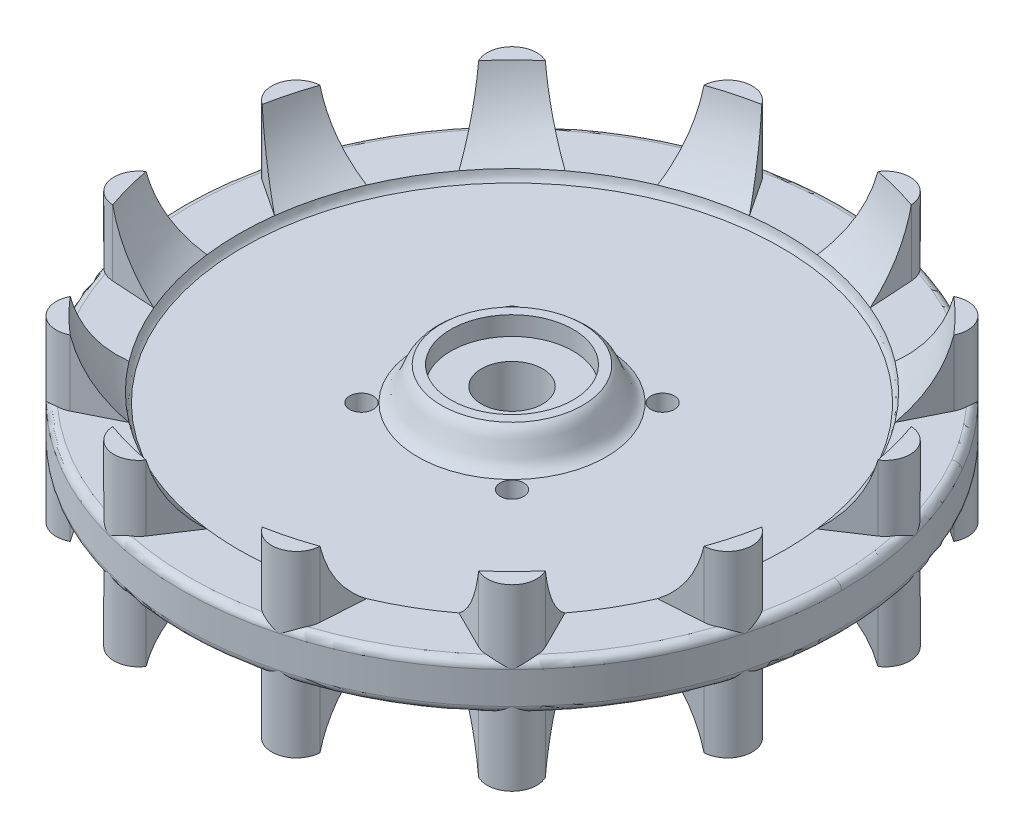
from build123d import *

# Parameters (mm, degrees)
BOSS_EXTRUDE1_DEPTH            = 7.9375
FILLET2_R                      = 2.54
BOSS_EXTRUDE3_START            = -38.1
BOSS_EXTRUDE3_DEPTH            = 60.325
CIRPATTERN8_COUNT              = 12
FILLET5_R                      = 2.54
CIRPATTERN9_COUNT              = 12
SKETCH5_R                      = 10.31875
CUT_EXTRUDE1_DEPTH             = 9.525
SKETCH7_R                      = 31.75
SKETCH7_R_2                    = 10.31875
BOSS_EXTRUDE4_DEPTH            = 15.875
CUT_EXTRUDE2_START             = -6.35
SKETCH8_R                      = 20.6375
SKETCH8_R_2                    = 10.31875
CUT_EXTRUDE2_DEPTH             = 6.35
CUT_EXTRUDE3_REACH             = 162.023
SKETCH10_R                     = 3.968750000000001
SKETCH10_R_2                   = 3.9687499999994156
SKETCH10_R_3                   = 3.968749999999999
SKETCH10_R_4                   = 3.9687499999996922
CUT_EXTRUDE3_DIRECTION_2_REACH = 162.023


with BuildPart() as part:
    # Sketch1 → Boss-Extrude1 (new, symmetric)
    with BuildSketch(Plane(origin=(0, 0, 0), x_dir=(1, 0, 0), z_dir=(0, 1, 0))):
        with BuildLine():
            Line((0, 0), (111.125, 0))
            ThreePointArc((111.125, 0), (107.33850744637269, 28.7612663870177), (96.23707299554566, 55.56250000000014))
            Line((96.23707299554566, 55.56250000000014), (0, 0))
        make_face()
    boss_extrude1 = extrude(amount=BOSS_EXTRUDE1_DEPTH, both=True)

    # Fillet2
    fillet2_edges = [part.edges().sort_by_distance(p)[0] for p in [
        (107.33850744637266, 7.9375, -28.7612663870177),
        (107.33850744637266, -7.9375, -28.7612663870177),
    ]]
    fillet(fillet2_edges, radius=FILLET2_R)

    # Sketch3 → Boss-Extrude3 (add)
    with BuildSketch(Plane(origin=(0, 7.9375, 0), x_dir=(1, 0, 0), z_dir=(0, 1, 0)).offset(BOSS_EXTRUDE3_START)):
        with BuildLine():
            Line((84.80053818599464, 35.870243215869976), (99.76659115583168, 34.9498822138162))
            ThreePointArc((99.76659115583168, 34.9498822138162), (107.3385074463727, 28.7612663870177), (103.87534349683419, 19.615809721477245))
            Line((103.87534349683419, 19.615809721477245), (91.37454193159867, 11.335727228127643))
            ThreePointArc((91.37454193159867, 11.335727228127643), (88.93762045556595, 23.83076357781467), (84.80053818599464, 35.870243215869976))
        make_face()
    boss_extrude3 = extrude(amount=BOSS_EXTRUDE3_DEPTH)

    # CirPattern8: Boss-Extrude1 ×12 about axis
    cirpattern8_axis = Axis((0, 7.9375, 0), (0, -1, 0))
    for i in range(1, CIRPATTERN8_COUNT):
        add(boss_extrude1.rotate(cirpattern8_axis, i * 360 / CIRPATTERN8_COUNT))

    # Fillet5
    # the kernel refuses this fillet: 2.54 mm, written as the material it takes off along each edge
    with BuildSketch(Plane(origin=(-7.662e-14, -7.9375, 3.0856e-13), x_dir=(0.9983500559192122, 0, -0.05742095302331489), z_dir=(-0.05742095302331489, 0, -0.9983500559192122))) as fillet5_piece_1:
        with BuildLine():
            CenterArc((111.12500000000007 - FILLET5_R, -FILLET5_R), FILLET5_R, 2.003e-14, 90)
            Line((111.12500000000007, -FILLET5_R), (111.12500000000007, 0))
            Line((111.12500000000007, 0), (111.12500000000007 - FILLET5_R, 0))
        make_face()
    revolve(axis=Axis((-7.662e-14, -7.9375, 3.0856e-13), (0, -1, 0)), revolution_arc=336.58357777120347, mode=Mode.SUBTRACT)
    with BuildSketch(Plane(origin=(-3.0856e-13, 7.9375, -7.662e-14), x_dir=(0.9983500559192126, 0, -0.05742095302331143), z_dir=(-0.05742095302331143, 0, -0.9983500559192126))) as fillet5_piece_2:
        with BuildLine():
            CenterArc((111.12500000000031 - FILLET5_R, FILLET5_R), FILLET5_R, 270, 90)
            Line((111.12500000000031 - FILLET5_R, -8.9e-16), (111.12500000000031, 0))
            Line((111.12500000000031, 0), (111.12500000000031, FILLET5_R))
        make_face()
    revolve(axis=Axis((-3.0856e-13, 7.9375, -7.662e-14), (0, -1, 0)), revolution_arc=336.5835777712035, mode=Mode.SUBTRACT)

    # CirPattern9: Boss-Extrude3 ×12 about axis
    cirpattern9_axis = Axis((3.94e-15, 0, 1.612e-14), (0, 1, 0))
    for i in range(1, CIRPATTERN9_COUNT):
        add(boss_extrude3.rotate(cirpattern9_axis, i * 360 / CIRPATTERN9_COUNT))

    # Sketch4 → Cut-Revolve1 (revolve, cut)
    with BuildSketch(Plane(origin=(0, 0, 0), x_dir=(0, 0, -1), z_dir=(1, 0, 0)), mode=Mode.PRIVATE) as cut_revolve1_sk:
        with BuildLine():
            Line((7.45e-15, 4.762500000000012), (-90.76614020052881, 4.7625))
            add(Edge.make_bspline(
                [(-92.202, 7.937499999999993), (-91.97023233311828, 6.782175786314355), (-91.80871994311016, 5.592594784916998), (-90.76614020052881, 4.7625)],
                knots=[0, 0, 0, 0, 1, 1, 1, 1], degree=3))
            add(Edge.make_bspline(
                [(-105.66399999999999, 30.162499999999998), (-102.69114867902013, 16.630187190377157), (-92.202, 7.937499999999993)],
                knots=[0, 0, 0, 1, 1, 1], degree=2))
            Line((-105.66399999999999, 30.162499999999998), (0, 30.162499999999998))
            Line((0, 30.162499999999998), (0, 7.937499999999993))
            Line((0, 7.937499999999993), (7.45e-15, 4.762500000000012))
        make_face()
    cut_revolve1 = revolve(cut_revolve1_sk.sketch.rotate(Axis((0, 7.9375, 0), (0, -1, 0)), 165), axis=Axis((0, 7.9375, 0), (0, -1, 0)), mode=Mode.SUBTRACT)

    # Mirror7: Cut-Revolve1 across plane
    add(cut_revolve1.mirror(Plane.ZX), mode=Mode.SUBTRACT)

    # Sketch5 → Cut-Extrude1 (cut)
    with BuildSketch(Plane(origin=(0, 4.762500000000006, 0), x_dir=(1, 0, 0), z_dir=(0, 1, 0))):
        with Locations(Location((0, 0, 0), (0, 0, 270))):
            Circle(SKETCH5_R)
    extrude(amount=-CUT_EXTRUDE1_DEPTH, mode=Mode.SUBTRACT)

    # Sketch7 → Boss-Extrude4 (add, symmetric)
    with BuildSketch(Plane(origin=(0, 0, 0), x_dir=(1, 0, 0), z_dir=(0, 1, 0))):
        with Locations(Location((0, 0, 0), (0, 0, 270))):
            Circle(SKETCH7_R)
        with Locations(Location((0, 0, 0), (0, 0, 270))):
            Circle(SKETCH7_R_2, mode=Mode.SUBTRACT)
    extrude(amount=BOSS_EXTRUDE4_DEPTH, both=True)

    # Sketch8 → Cut-Extrude2 (cut)
    with BuildSketch(Plane(origin=(0, 15.875, 0), x_dir=(1, 0, 0), z_dir=(0, 1, 0)).offset(CUT_EXTRUDE2_START)):
        with Locations(Location((0, 0, 0), (0, 0, 270))):
            Circle(SKETCH8_R)
        with Locations(Location((0, 0, 0), (0, 0, 270))):
            Circle(SKETCH8_R_2, mode=Mode.SUBTRACT)
    extrude(amount=CUT_EXTRUDE2_DEPTH, mode=Mode.SUBTRACT)

    # Sketch9 → Cut-Revolve2 (revolve, cut)
    with BuildSketch(Plane.XY, mode=Mode.PRIVATE) as cut_revolve2_sk:
        with BuildLine():
            Line((31.75, 4.762500000000006), (31.75, 15.875))
            Line((31.75, 15.875), (23.8125, 15.875))
            add(Edge.make_bspline(
                [(23.8125, 15.875), (27.99340871529447, 13.122750259069653), (26.399199882082343, 6.530738908145436), (31.75, 4.762500000000006)],
                knots=[0, 0, 0, 0, 1, 1, 1, 1], degree=3))
        make_face()
        with BuildLine():
            Line((19.05, -15.875), (31.75, -15.875))
            Line((31.75, -15.875), (31.75, -4.762500000000006))
            add(Edge.make_bspline(
                [(31.75, -4.762500000000006), (29.118294345699717, -5.875373648517392), (25.96362960914951, -9.38294589726199), (23.62306654237736, -13.620249806474819), (21.195415202598316, -15.366270030692574), (19.05, -15.875)],
                knots=[0, 0, 0, 0, 0.499315320454434, 0.581239458352903, 1, 1, 1, 1], degree=3))
        make_face()
    revolve(cut_revolve2_sk.sketch.rotate(Axis((0, -33.94833239347475, 0), (0, 1, 0)), 270), axis=Axis((0, -33.94833239347475, 0), (0, 1, 0)), mode=Mode.SUBTRACT)

    # Cut-Extrude3: up to this face of the body (flat: up to its plane)
    cut_extrude3_end = Plane(part.part.faces().sort_by_distance((22.827551472, -4.7625, 85.193581906))[0])
    # Sketch10 → Cut-Extrude3 (cut, up to the picked face)
    with BuildSketch(Plane(origin=(0, 0, 0), x_dir=(1, 0, 0), z_dir=(0, 1, 0)), mode=Mode.PRIVATE) as cut_extrude3_sk1:
        with Locations(Location((-25.396164310383693, -25.39616431038344, 0), (0, 0, 270))):
            Circle(SKETCH10_R)
    cut_extrude3_tool1 = split(extrude(cut_extrude3_sk1.sketch, amount=-CUT_EXTRUDE3_REACH, mode=Mode.PRIVATE), bisect_by=cut_extrude3_end, keep=Keep.BOTH, mode=Mode.PRIVATE)
    # Sketch10 → Cut-Extrude3 (cut, up to the picked face)
    with BuildSketch(Plane(origin=(0, 0, 0), x_dir=(1, 0, 0), z_dir=(0, 1, 0)), mode=Mode.PRIVATE) as cut_extrude3_sk2:
        with Locations(Location((-25.396164310383416, 25.396164310383153, 0), (0, 0, 270))):
            Circle(SKETCH10_R_2)
    cut_extrude3_tool2 = split(extrude(cut_extrude3_sk2.sketch, amount=-CUT_EXTRUDE3_REACH, mode=Mode.PRIVATE), bisect_by=cut_extrude3_end, keep=Keep.BOTH, mode=Mode.PRIVATE)
    # Sketch10 → Cut-Extrude3 (cut, up to the picked face)
    with BuildSketch(Plane(origin=(0, 0, 0), x_dir=(1, 0, 0), z_dir=(0, 1, 0)), mode=Mode.PRIVATE) as cut_extrude3_sk3:
        with Locations(Location((25.396164310383877, 25.39616431038327, 0), (0, 0, 270))):
            Circle(SKETCH10_R_3)
    cut_extrude3_tool3 = split(extrude(cut_extrude3_sk3.sketch, amount=-CUT_EXTRUDE3_REACH, mode=Mode.PRIVATE), bisect_by=cut_extrude3_end, keep=Keep.BOTH, mode=Mode.PRIVATE)
    # Sketch10 → Cut-Extrude3 (cut, up to the picked face)
    with BuildSketch(Plane(origin=(0, 0, 0), x_dir=(1, 0, 0), z_dir=(0, 1, 0)), mode=Mode.PRIVATE) as cut_extrude3_sk4:
        with Locations(Location((25.396164310382925, -25.39616431038371, 0), (0, 0, 270))):
            Circle(SKETCH10_R_4)
    cut_extrude3_tool4 = split(extrude(cut_extrude3_sk4.sketch, amount=-CUT_EXTRUDE3_REACH, mode=Mode.PRIVATE), bisect_by=cut_extrude3_end, keep=Keep.BOTH, mode=Mode.PRIVATE)
    add(cut_extrude3_tool1.solids().sort_by(Axis((-25.396164, 0, 25.396164), (0, -1, 0)))[0], mode=Mode.SUBTRACT)
    add(cut_extrude3_tool2.solids().sort_by(Axis((-25.396164, 0, -25.396164), (0, -1, 0)))[0], mode=Mode.SUBTRACT)
    add(cut_extrude3_tool3.solids().sort_by(Axis((25.396164, 0, -25.396164), (0, -1, 0)))[0], mode=Mode.SUBTRACT)
    add(cut_extrude3_tool4.solids().sort_by(Axis((25.396164, 0, 25.396164), (0, -1, 0)))[0], mode=Mode.SUBTRACT)

    # Cut-Extrude3 direction 2: up to this face of the body (flat: up to its plane)
    cut_extrude3_direction_2_end = Plane(part.part.faces().sort_by_distance((22.827551472, 4.7625, 85.193581906))[0])
    # Sketch10 → Cut-Extrude3 direction 2 (cut, up to the picked face)
    with BuildSketch(Plane(origin=(0, 0, 0), x_dir=(1, 0, 0), z_dir=(0, 1, 0)), mode=Mode.PRIVATE) as cut_extrude3_direction_2_sk1:
        with Locations(Location((-25.396164310383693, -25.39616431038344, 0), (0, 0, 270))):
            Circle(SKETCH10_R)
    cut_extrude3_direction_2_tool1 = split(extrude(cut_extrude3_direction_2_sk1.sketch, amount=CUT_EXTRUDE3_DIRECTION_2_REACH, mode=Mode.PRIVATE), bisect_by=cut_extrude3_direction_2_end, keep=Keep.BOTH, mode=Mode.PRIVATE)
    # Sketch10 → Cut-Extrude3 direction 2 (cut, up to the picked face)
    with BuildSketch(Plane(origin=(0, 0, 0), x_dir=(1, 0, 0), z_dir=(0, 1, 0)), mode=Mode.PRIVATE) as cut_extrude3_direction_2_sk2:
        with Locations(Location((-25.396164310383416, 25.396164310383153, 0), (0, 0, 270))):
            Circle(SKETCH10_R_2)
    cut_extrude3_direction_2_tool2 = split(extrude(cut_extrude3_direction_2_sk2.sketch, amount=CUT_EXTRUDE3_DIRECTION_2_REACH, mode=Mode.PRIVATE), bisect_by=cut_extrude3_direction_2_end, keep=Keep.BOTH, mode=Mode.PRIVATE)
    # Sketch10 → Cut-Extrude3 direction 2 (cut, up to the picked face)
    with BuildSketch(Plane(origin=(0, 0, 0), x_dir=(1, 0, 0), z_dir=(0, 1, 0)), mode=Mode.PRIVATE) as cut_extrude3_direction_2_sk3:
        with Locations(Location((25.396164310383877, 25.39616431038327, 0), (0, 0, 270))):
            Circle(SKETCH10_R_3)
    cut_extrude3_direction_2_tool3 = split(extrude(cut_extrude3_direction_2_sk3.sketch, amount=CUT_EXTRUDE3_DIRECTION_2_REACH, mode=Mode.PRIVATE), bisect_by=cut_extrude3_direction_2_end, keep=Keep.BOTH, mode=Mode.PRIVATE)
    # Sketch10 → Cut-Extrude3 direction 2 (cut, up to the picked face)
    with BuildSketch(Plane(origin=(0, 0, 0), x_dir=(1, 0, 0), z_dir=(0, 1, 0)), mode=Mode.PRIVATE) as cut_extrude3_direction_2_sk4:
        with Locations(Location((25.396164310382925, -25.39616431038371, 0), (0, 0, 270))):
            Circle(SKETCH10_R_4)
    cut_extrude3_direction_2_tool4 = split(extrude(cut_extrude3_direction_2_sk4.sketch, amount=CUT_EXTRUDE3_DIRECTION_2_REACH, mode=Mode.PRIVATE), bisect_by=cut_extrude3_direction_2_end, keep=Keep.BOTH, mode=Mode.PRIVATE)
    add(cut_extrude3_direction_2_tool1.solids().sort_by(Axis((-25.396164, 0, 25.396164), (0, 1, 0)))[0], mode=Mode.SUBTRACT)
    add(cut_extrude3_direction_2_tool2.solids().sort_by(Axis((-25.396164, 0, -25.396164), (0, 1, 0)))[0], mode=Mode.SUBTRACT)
    add(cut_extrude3_direction_2_tool3.solids().sort_by(Axis((25.396164, 0, -25.396164), (0, 1, 0)))[0], mode=Mode.SUBTRACT)
    add(cut_extrude3_direction_2_tool4.solids().sort_by(Axis((25.396164, 0, 25.396164), (0, 1, 0)))[0], mode=Mode.SUBTRACT)


solid = part.part
